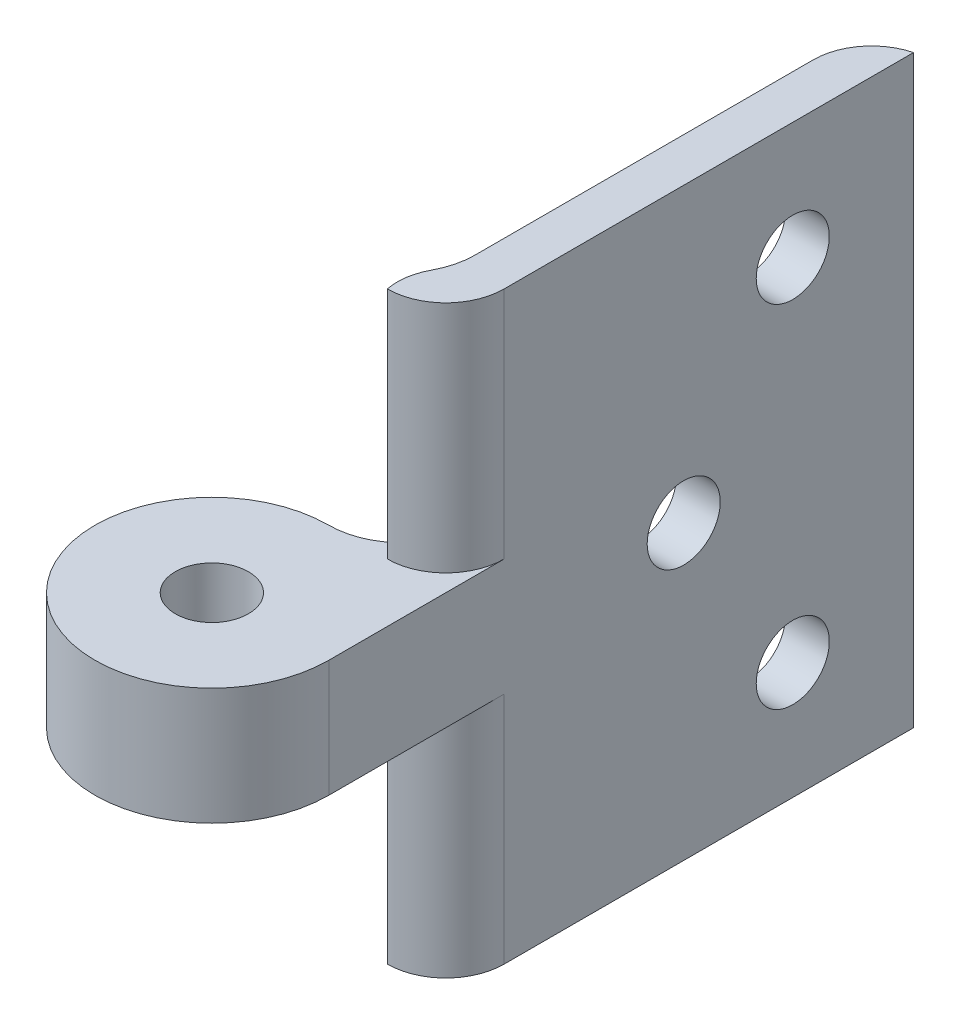
from build123d import *

# Parameters (mm, degrees)
SKETCH1_R               = 1.25
BOSS_EXTRUDE1_DEPTH     = 20
CUT_EXTRUDE1_DEPTH      = 30.021543722
CUT_EXTRUDE1_DEPTH_BACK = 30.021543722
SKETCH2_R               = 1.25
CUT_EXTRUDE3_DEPTH      = 29.565713714
CUT_EXTRUDE3_DEPTH_BACK = 29.565713714
SKETCH3_W               = 10
SKETCH3_H               = 8
SKETCH3_W_2             = 9.357078711
FILLET3_R               = 2
FILLET4_R               = 2
FILLET8_R               = 2
FILLET9_R               = 2
FILLET11_R              = 2


with BuildPart() as part:
    # Sketch1 → Boss-Extrude1 (new body)
    with BuildSketch(Plane(origin=(0, 0, 0), x_dir=(1, 0, 0), z_dir=(0, 1, 0))):
        with BuildLine():
            Line((4, 0), (4, 20))
            Line((4, 20), (2.5, 20))
            Line((2.5, 20), (2.5, 15.120027663))
            Line((2.5, 15.120027663), (2.5, 6.5))
            ThreePointArc((2.5, 6.5), (1.767766953, 4.732233047), (0, 4))
            ThreePointArc((0, 4), (-2.828427125, -2.828427125), (4, 0))
        make_face()
        with Locations(Location((0, 0, 0), (0, 0, 270))):
            Circle(SKETCH1_R, mode=Mode.SUBTRACT)
    extrude(amount=BOSS_EXTRUDE1_DEPTH)

    # Sketch2 → Cut-Extrude1 (cut, two sides: drawn at the far end of the back side and taken through both)
    with BuildSketch(Plane.ZY.offset(-2.5).offset(-CUT_EXTRUDE1_DEPTH_BACK)):
        with Locations((-12.139236455, 10)):
            Circle(SKETCH2_R)
        with Locations((-15.86873762, 4)):
            Circle(SKETCH2_R)
        with Locations((-15.86873762, 16)):
            Circle(SKETCH2_R)
    extrude(amount=CUT_EXTRUDE1_DEPTH + CUT_EXTRUDE1_DEPTH_BACK, mode=Mode.SUBTRACT)

    # Sketch3 → Cut-Extrude3 (cut, two sides: drawn at the far end of the back side and taken through both)
    with BuildSketch(Plane(origin=(0, 0, 0), x_dir=(0, 0, -1), z_dir=(1, 0, 0)).offset(-CUT_EXTRUDE3_DEPTH_BACK)):
        with Locations((-1, 4)):
            Rectangle(SKETCH3_W, SKETCH3_H)
        with Locations((-0.678539356, 16)):
            Rectangle(SKETCH3_W_2, SKETCH3_H)
    extrude(amount=CUT_EXTRUDE3_DEPTH + CUT_EXTRUDE3_DEPTH_BACK, mode=Mode.SUBTRACT)

    # Fillet3
    fillet3_edges = [part.edges().sort_by_distance(p)[0] for p in [
        (4, 16, -4),
    ]]
    fillet(fillet3_edges, radius=FILLET3_R)

    # Fillet4
    # the kernel refuses this fillet: 2 mm, written as the material it takes off along each edge
    with BuildSketch(Plane(origin=(0, 12, -4), x_dir=(0.8581589387978472, 0, -0.513384101586086), z_dir=(0, 1, 0))) as fillet4_piece_1:
        with BuildLine():
            CenterArc((3.593688711, -1.716317878), FILLET4_R, 120.889507128, 38.942441269)
            Line((1.716317878, -1.026768203), (0, 0))
            ThreePointArc((0, 0), (1.283460254, -0.354602653), (2.566920508, 0))
        make_face()
    extrude(amount=14.41730127, mode=Mode.SUBTRACT)

    # Fillet8
    fillet8_edges = [part.edges().sort_by_distance(p)[0] for p in [
        (4, 4, -4),
    ]]
    fillet(fillet8_edges, radius=FILLET8_R)

    # Fillet9
    # the kernel refuses this fillet: 2 mm, written as the material it takes off along each edge
    with BuildSketch(Plane(origin=(0, -6.41730127, -4), x_dir=(0.8581589387978472, 0, -0.513384101586086), z_dir=(0, 1, 0))) as fillet9_piece_1:
        with BuildLine():
            CenterArc((3.593688711, -1.716317878), FILLET9_R, 120.889507128, 38.942441269)
            Line((1.716317878, -1.026768203), (1.678770461, -1.01297721))
            ThreePointArc((1.678770461, -1.01297721), (0.837623575, -0.547710459), (-0.020535364, -0.034326358))
            Line((-0.020535364, -0.034326358), (0.020535364, 0.034326358))
            ThreePointArc((0.020535364, 0.034326358), (1.283460254, -0.314602653), (2.546385144, 0.034326358))
            Line((2.546385144, 0.034326358), (2.566920508, 0))
        make_face()
    extrude(amount=14.41730127, mode=Mode.SUBTRACT)

    # Fillet11
    # the kernel refuses this fillet: 2 mm, written as the material it takes off along each edge
    with BuildSketch(Plane(origin=(2.5, -4.841229183, -20), x_dir=(1, 0, 0), z_dir=(0, 1, 0))) as fillet11_piece_1:
        with BuildLine():
            CenterArc((2, -1.936491673), FILLET11_R, 104.477512186, 75.522487814)
            Line((0, -1.936491673), (-0.04, -1.936491673))
            Line((-0.04, -1.936491673), (-0.04, 0))
            Line((-0.04, 0), (0, 0.04))
            ThreePointArc((0, 0.04), (0.75, 0.04), (1.49, 0.038729833))
            Line((1.49, 0.038729833), (1.5, 0))
        make_face()
    extrude(amount=29.682458366, mode=Mode.SUBTRACT)


solid = part.part
